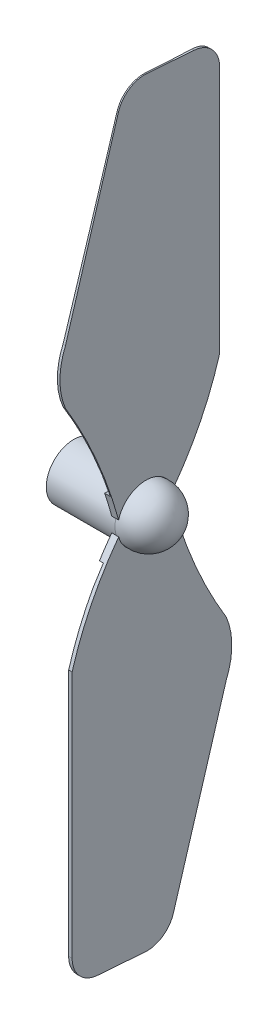
from build123d import *

# Parameters (mm, degrees)
SKETCH2_R               = 4
BOSS_EXTRUDE1_DEPTH     = 10
BOSS_EXTRUDE2_DEPTH     = 0.5
CUT_EXTRUDE1_DEPTH      = 342.170230924
CUT_EXTRUDE1_DEPTH_BACK = 51.074207
CIRPATTERN4_COUNT       = 2
SKETCH6_W               = 0.5
SKETCH6_H               = 45.949265896
CUT_EXTRUDE2_DEPTH      = 78.646025062
SKETCH7_W               = 0.5
SKETCH7_H               = 45.949265896
CUT_EXTRUDE3_DEPTH      = 78.890144412


# Read off the part's stored shape, not the designer's step: Dome1
with BuildPart() as part:
    # Sketch2 → Boss-Extrude1 (new body)
    with BuildSketch(Plane(origin=(0, 0, 0), x_dir=(0, 0, -1), z_dir=(1, 0, 0))):
        with Locations((-324.05224168, 4.658068072)):
            Circle(SKETCH2_R)
    extrude(amount=-BOSS_EXTRUDE1_DEPTH)

    # Dome1 outline → Dome1 (revolve)
    with BuildSketch(Plane(origin=(0, 4.658068072, 324.05224168), x_dir=(0, 1, 0), z_dir=(0, 0, -1))):
        with BuildLine():
            Line((0, 0), (3.999999999, -2e-09))
            ThreePointArc((3.999999999, -2e-09), (3.201562119, 3.461249694), (0, 5))
            Line((0, 5), (0, 0))
        make_face()
    revolve(axis=Axis((0, 4.658068072, 324.05224168), (1, 0, 0)))


with BuildPart() as body_2:
    # Sketch4 → Boss-Extrude2 (new, symmetric)
    with BuildSketch(Plane(origin=(0, 0, 0), x_dir=(0, 0, -1), z_dir=(1, 0, 0))):
        with BuildLine():
            Line((-335.767562581, 31.555248006), (-328.054608207, 57.13040072))
            ThreePointArc((-328.054608207, 57.13040072), (-326.4894253, 59.272769198), (-323.927948207, 59.964416025))
            Line((-323.927948207, 59.964416025), (-317.016076638, 59.449746784))
            ThreePointArc((-317.016076638, 59.449746784), (-314.381540118, 58.182177747), (-313.313100875, 55.460789953))
            Line((-313.313100875, 55.460789953), (-313.313100875, 19.360920004))
            ThreePointArc((-313.313100875, 19.360920004), (-316.098708577, 12.238106754), (-320.090663433, 5.714428706))
            ThreePointArc((-320.090663433, 5.714428706), (-324.05224168, 8.758068072), (-328.013819928, 5.714428706))
            ThreePointArc((-328.013819928, 5.714428706), (-331.268929904, 14.967718201), (-335.767562581, 23.684449897))
            ThreePointArc((-335.767562581, 23.684449897), (-336.559382592, 27.619848952), (-335.767562581, 31.555248006))
        make_face()
    extrude(amount=BOSS_EXTRUDE2_DEPTH, both=True)

    # Sketch5 → Cut-Extrude1 (cut, two sides: drawn at the far end of the back side and taken through both)
    with BuildSketch(Plane(origin=(0, 35.646568561, -2.654301687), x_dir=(1, 0, 0), z_dir=(0, 0.9972392078358424, -0.07425605938199077)).offset(-CUT_EXTRUDE1_DEPTH_BACK)):
        with BuildLine():
            Line((0, -316.802311965), (-0.520390327, -316.802311965))
            Line((-0.520390327, -316.802311965), (-0.520390327, -340.19413973))
            Line((-0.520390327, -340.19413973), (0, -340.19413973))
            ThreePointArc((0, -340.19413973), (0.326340989, -328.498225847), (0, -316.802311965))
        make_face()
    extrude(amount=CUT_EXTRUDE1_DEPTH + CUT_EXTRUDE1_DEPTH_BACK, mode=Mode.SUBTRACT)


with BuildPart() as cirpattern4_1:
    # CirPattern4: pattern copy
    add(body_2.part.rotate(Axis((0, 4.658068072, 324.05224168), (1, 0, 0)), 1 * 360 / CIRPATTERN4_COUNT))

    # Sketch7 → Cut-Extrude3 (cut, through all)
    with BuildSketch(Plane(origin=(0, 24.519697522, 329.293042712), x_dir=(-1, 0, 0), z_dir=(0, -0.07425605938199076, -0.9972392078358424))):
        with Locations((0.25, -48.989577583)):
            Rectangle(SKETCH7_W, SKETCH7_H)
    extrude(amount=-CUT_EXTRUDE3_DEPTH, mode=Mode.SUBTRACT)


with BuildPart() as body_2_1:
    add(body_2.part)

    # Sketch6 → Cut-Extrude2 (cut, through all)
    with BuildSketch(Plane(origin=(0, 23.52449129, 315.927686624), x_dir=(1, 0, 0), z_dir=(0, 0.07425605938199076, 0.9972392078358424))):
        with Locations((-0.25, 10.15430881)):
            Rectangle(SKETCH6_W, SKETCH6_H)
    extrude(amount=-CUT_EXTRUDE2_DEPTH, mode=Mode.SUBTRACT)


solid = Compound([part.part, cirpattern4_1.part, body_2_1.part])
